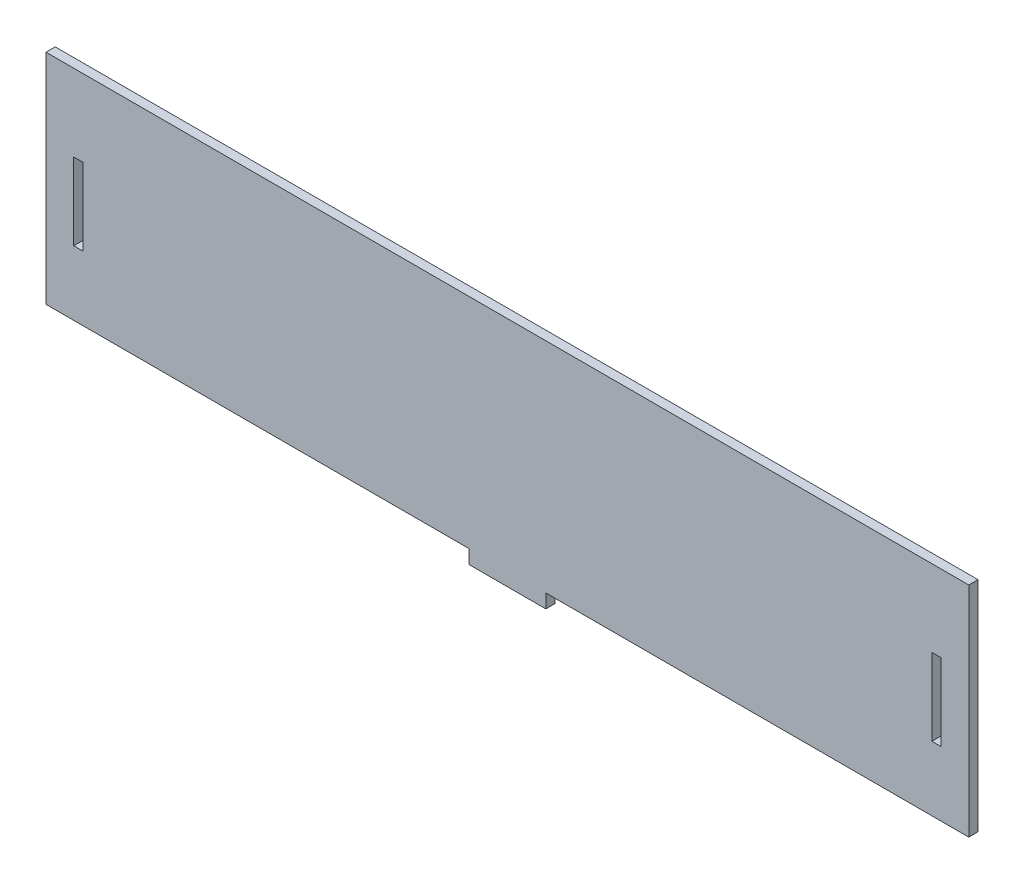
from build123d import *

# Parameters (mm, degrees)
SKETCH1_W           = 6
SKETCH1_H           = 50
BOSS_EXTRUDE1_DEPTH = 6


with BuildPart() as part:
    # Sketch1 → Boss-Extrude1 (new body)
    with BuildSketch(Plane.XY):
        Polygon((0, 0), (600, 0), (600, -142), (325, -142), (325, -151), (275, -151), (275, -142), (0, -142), align=None)
        with Locations((579, -75)):
            Rectangle(SKETCH1_W, SKETCH1_H, mode=Mode.SUBTRACT)
        with Locations((21, -75)):
            Rectangle(SKETCH1_W, SKETCH1_H, mode=Mode.SUBTRACT)
    extrude(amount=BOSS_EXTRUDE1_DEPTH)


solid = part.part
